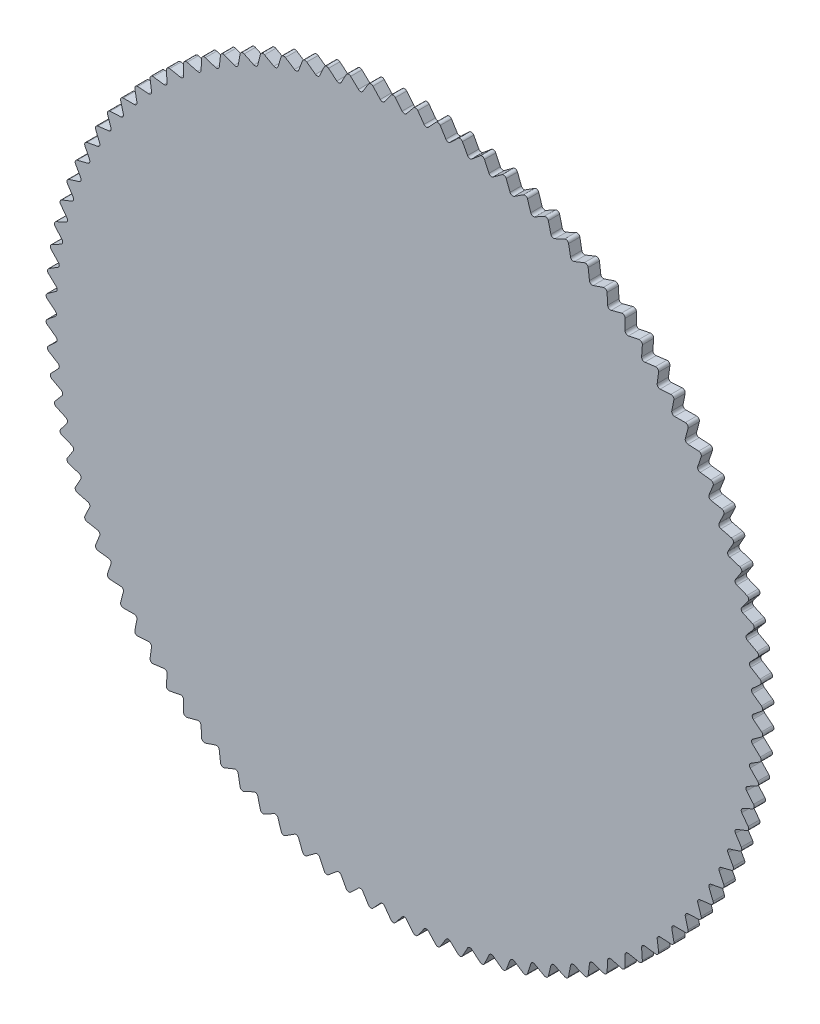
from build123d import *

# Parameters (mm, degrees)
SKETCH2_R           = 253.75
BOSS_EXTRUDE1_DEPTH = 8
CUT_EXTRUDE3_START  = -20
CUT_EXTRUDE3_DEPTH  = 20
CIRPATTERN1_COUNT   = 100


with BuildPart() as part:
    # Sketch2 → Boss-Extrude1 (new body)
    with BuildSketch(Plane.XY):
        Circle(SKETCH2_R)
    extrude(amount=BOSS_EXTRUDE1_DEPTH)

    # Sketch4 → Cut-Extrude3 (cut)
    with BuildSketch(Plane.XY.offset(8).offset(CUT_EXTRUDE3_START)):
        with BuildLine():
            ThreePointArc((-1.55081733, 246.987080521), (0, 246.25), (1.55081733, 246.987080521))
            Line((1.55081733, 246.987080521), (6.356841268, 252.888696051))
            ThreePointArc((6.356841268, 252.888696051), (7.077603572, 253.445394294), (7.970480116, 253.624789693))
            ThreePointArc((7.970480116, 253.624789693), (0, 253.75), (-7.970480116, 253.624789693))
            ThreePointArc((-7.970480116, 253.624789693), (-7.077603572, 253.445394294), (-6.356841268, 252.888696051))
            Line((-6.356841268, 252.888696051), (-1.55081733, 246.987080521))
        make_face()
    cut_extrude3 = extrude(amount=CUT_EXTRUDE3_DEPTH, mode=Mode.SUBTRACT)

    # CirPattern1: Cut-Extrude3 ×100 about axis
    cirpattern1_axis = Axis((0, 0, 0), (0, 0, 1))
    for i in range(1, CIRPATTERN1_COUNT):
        add(cut_extrude3.rotate(cirpattern1_axis, i * 360 / CIRPATTERN1_COUNT), mode=Mode.SUBTRACT)


solid = part.part
